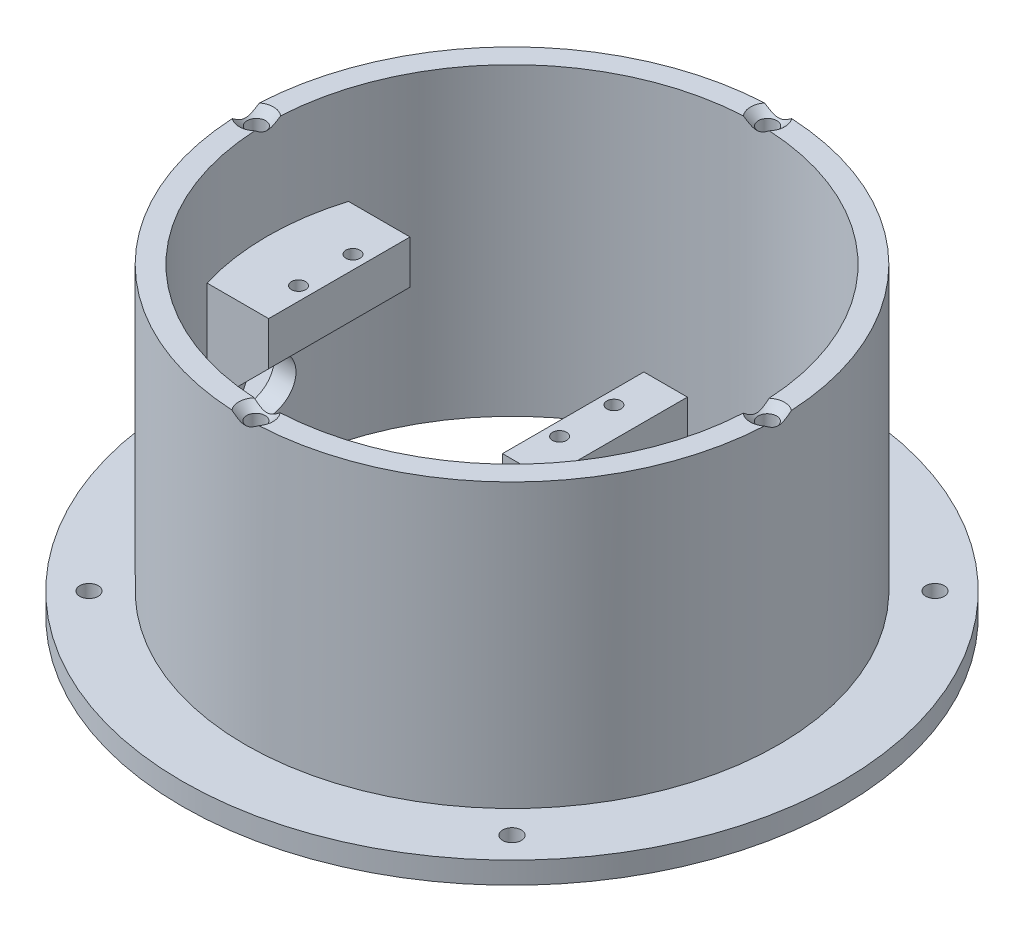
from build123d import *

# Parameters (mm, degrees)
BOSS_EXTRUDE1_START                             = -18.668682
BOSS_EXTRUDE1_OUTLINE_R                         = 49
BOSS_EXTRUDE1_DEPTH                             = 18.668682
BOSS_EXTRUDE1_START_2                           = -56
BOSS_EXTRUDE1_2_OUTLINE_R                       = 49
BOSS_EXTRUDE1_2_OUTLINE_R_2                     = 45
BOSS_EXTRUDE1_2_DEPTH                           = 37.331318
BOSS_EXTRUDE1_START_3                           = -4
BOSS_EXTRUDE1_3_OUTLINE_R                       = 60.625
BOSS_EXTRUDE1_3_OUTLINE_R_2                     = 49
BOSS_EXTRUDE1_3_DEPTH                           = 4
BOSS_EXTRUDE1_START_4                           = -13
BOSS_EXTRUDE1_4_DEPTH                           = 26
CUT_EXTRUDE1_DEPTH                              = 1.918682
CUT_EXTRUDE2_REACH                              = 112.599
CUT_EXTRUDE3_DEPTH                              = 103.404986
CUT_EXTRUDE4_DEPTH                              = 103.404986
CUT_EXTRUDE5_DEPTH                              = 12.75
CUT_EXTRUDE6_DEPTH                              = 18
SKETCH16_W                                      = 8
SKETCH16_H                                      = 26
BOSS_EXTRUDE2_DEPTH                             = 34
CUT_EXTRUDE7_DEPTH                              = 101.273532
CUT_EXTRUDE8_REACH                              = 111.441
SKETCH23_W                                      = 10
SKETCH23_H                                      = 24
F_3_4_3_4_DIAMETER_HOLE1_D                      = 3.4
SKETCH26_W                                      = 5
SKETCH26_H                                      = 105.34636
F_2_6_2_6_DIAMETER_HOLE1_D                      = 2.6
F_2_6_2_6_DIAMETER_HOLE1_DEPTH                  = 7.2
CSK_FOR_M3_FLAT_HEAD_MACHINE_SCREW1_D           = 3.4
CSK_FOR_M3_FLAT_HEAD_MACHINE_SCREW1_DEPTH       = 30.178537
CSK_FOR_M3_FLAT_HEAD_MACHINE_SCREW1_CSINK_D     = 6.3
CSK_FOR_M3_FLAT_HEAD_MACHINE_SCREW1_CSINK_ANGLE = 90
CSK_FOR_M3_FLAT_HEAD_MACHINE_SCREW1_TIP         = 1.021463


with BuildPart() as part:
    # Boss-Extrude1: read off the stored shape, not the designer's step
    # Boss-Extrude1 outline → Boss-Extrude1 (new body)
    with BuildSketch(Plane.XZ.offset(BOSS_EXTRUDE1_START)):
        Circle(BOSS_EXTRUDE1_OUTLINE_R)
        with BuildLine():
            Line((-10.445584, 13), (29.067401, -34.352383))
            ThreePointArc((29.067401, -34.352383), (-34.551051, -28.830971), (-28.593183, 34.748092))
            Line((-28.593183, 34.748092), (-10.445584, 13))
        make_face(mode=Mode.SUBTRACT)
    extrude(amount=BOSS_EXTRUDE1_DEPTH)

    # Boss-Extrude1 2 outline → Boss-Extrude1 2 (add)
    with BuildSketch(Plane.XZ.offset(BOSS_EXTRUDE1_START_2)):
        Circle(BOSS_EXTRUDE1_2_OUTLINE_R)
        Circle(BOSS_EXTRUDE1_2_OUTLINE_R_2, mode=Mode.SUBTRACT)
    extrude(amount=BOSS_EXTRUDE1_2_DEPTH)

    # Boss-Extrude1 3 outline → Boss-Extrude1 3 (add)
    with BuildSketch(Plane.XZ.offset(BOSS_EXTRUDE1_START_3)):
        Circle(BOSS_EXTRUDE1_3_OUTLINE_R)
        Circle(BOSS_EXTRUDE1_3_OUTLINE_R_2, mode=Mode.SUBTRACT)
    extrude(amount=BOSS_EXTRUDE1_3_DEPTH)

    # Boss-Extrude1 4 outline → Boss-Extrude1 4 (add)
    with BuildSketch(Plane.XY.offset(BOSS_EXTRUDE1_START_4)):
        Polygon((-46.75, 15), (-5.75, 56), (-47, 56), (-47, 15), align=None)
    extrude(amount=BOSS_EXTRUDE1_4_DEPTH)

    # Sketch2 → Cut-Extrude1 (cut)
    with BuildSketch(Plane(origin=(0, 18.668682, 0), x_dir=(-1, 0, 0), z_dir=(0, 1, 0))):
        with BuildLine():
            Line((-29.067401, -34.352383), (28.593183, 34.748092))
            ThreePointArc((28.593183, 34.748092), (-34.551051, 28.830971), (-29.067401, -34.352383))
        make_face()
    extrude(amount=-CUT_EXTRUDE1_DEPTH, mode=Mode.SUBTRACT)

    # Sketch7 → Cut-Extrude2 (cut, up to next)
    with BuildSketch(Plane.XY.offset(13), mode=Mode.PRIVATE) as cut_extrude2_sk1:
        Polygon((-31.75, 56), (-31.75, 30), (-5.75, 56), align=None)
    cut_extrude2_tool1 = extrude(cut_extrude2_sk1.sketch, amount=-CUT_EXTRUDE2_REACH, mode=Mode.PRIVATE) & part.part
    add(cut_extrude2_tool1.solids().sort_by_distance((-23.083333, 47.333333, 13))[0], mode=Mode.SUBTRACT)

    # Sketch12 → Cut-Extrude3 (cut, through all)
    with BuildSketch(Plane.XZ):
        with BuildLine():
            Line((-28.593183, 34.748092), (0.402208, 0))
            Line((0.402208, 0), (29.067401, 34.352383))
            ThreePointArc((29.067401, 34.352383), (0.308816, 44.99894), (-28.593183, 34.748092))
        make_face()
    extrude(amount=-CUT_EXTRUDE3_DEPTH, mode=Mode.SUBTRACT)

    # Sketch13 → Cut-Extrude4 (cut, through all)
    with BuildSketch(Plane.XZ):
        Polygon((0.402208, 0), (11.25, -13), (11.25, 13), align=None)
    extrude(amount=-CUT_EXTRUDE4_DEPTH, mode=Mode.SUBTRACT)

    # Sketch14 → Cut-Extrude5 (cut)
    with BuildSketch(Plane(origin=(0, 16.75, 0), x_dir=(-1, 0, 0), z_dir=(0, 1, 0))):
        with BuildLine():
            Line((-11.25, -13), (-11.25, 13))
            Line((-11.25, 13), (-29.067401, 34.352383))
            ThreePointArc((-29.067401, 34.352383), (-45, 0), (-29.067401, -34.352383))
            Line((-29.067401, -34.352383), (-11.25, -13))
        make_face()
    extrude(amount=-CUT_EXTRUDE5_DEPTH, mode=Mode.SUBTRACT)

    # Sketch15 → Cut-Extrude6 (cut)
    with BuildSketch(Plane(origin=(0, 56, 0), x_dir=(-1, 0, 0), z_dir=(0, 1, 0))):
        with BuildLine():
            Line((43.081318, 13), (31.75, 13))
            Line((31.75, 13), (31.75, -13))
            Line((31.75, -13), (43.081318, -13))
            ThreePointArc((43.081318, -13), (45, 0), (43.081318, 13))
        make_face()
    extrude(amount=-CUT_EXTRUDE6_DEPTH, mode=Mode.SUBTRACT)

    # Sketch16 → Boss-Extrude2 (add)
    with BuildSketch(Plane(origin=(0, 4, 0), x_dir=(-1, 0, 0), z_dir=(0, 1, 0))):
        with Locations((-15.25, 0)):
            Rectangle(SKETCH16_W, SKETCH16_H)
    extrude(amount=BOSS_EXTRUDE2_DEPTH)

    # Sketch17 → Cut-Extrude7 (cut, through all)
    with BuildSketch(Plane(origin=(0, 4, 0), x_dir=(-1, 0, 0), z_dir=(0, 1, 0))):
        with BuildLine():
            Line((-29.479537, -22.359715), (-24.25, -16.092635))
            Line((-24.25, -16.092635), (-24.25, 16.092635))
            Line((-24.25, 16.092635), (-29.479537, 22.359715))
            ThreePointArc((-29.479537, 22.359715), (-37, 0), (-29.479537, -22.359715))
        make_face()
    extrude(amount=-CUT_EXTRUDE7_DEPTH, mode=Mode.SUBTRACT)

    # Sketch23 → Cut-Extrude8 (cut, up to next)
    with BuildSketch(Plane.ZY.offset(-11.25), mode=Mode.PRIVATE) as cut_extrude8_sk1:
        with Locations((0, 17)):
            Rectangle(SKETCH23_W, SKETCH23_H)
    cut_extrude8_tool1 = extrude(cut_extrude8_sk1.sketch, amount=-CUT_EXTRUDE8_REACH, mode=Mode.PRIVATE) & part.part
    add(cut_extrude8_tool1.solids().sort_by_distance((11.25, 17, 0))[0], mode=Mode.SUBTRACT)

    # Ø3.4 (3.4) Diameter Hole1 (through all)
    with Locations(Plane(origin=(0, 4, 0), x_dir=(1, 0, 0), z_dir=(0, 1, 0))):
        with Locations((38.890873, 38.890873), (38.890873, -38.890873), (-38.890873, -38.890873), (-38.890873, 38.890873)):
            Hole(F_3_4_3_4_DIAMETER_HOLE1_D / 2)

    # Sketch26 → Ø10.0 (10) Diameter Hole1 (revolve, cut)
    with BuildSketch(Plane(origin=(44.72136, 14, 0), x_dir=(0, 0, -1), z_dir=(0, 1, 0))):
        with Locations((2.5, 52.67318)):
            Rectangle(SKETCH26_W, SKETCH26_H)
    revolve(axis=Axis((51.07136, 14, 0), (-1, 0, 0)), mode=Mode.SUBTRACT)

    # Ø2.6 (2.6) Diameter Hole1
    with Locations(Plane(origin=(0, 38, 0), x_dir=(1, 0, 0), z_dir=(0, 1, 0))):
        with Locations((13.75, -5), (13.75, 5), (-34.25, 5), (-34.25, -5)):
            Hole(F_2_6_2_6_DIAMETER_HOLE1_D / 2, depth=F_2_6_2_6_DIAMETER_HOLE1_DEPTH)

    # CSK for M3 Flat Head Machine Screw1
    with Locations(Plane(origin=(0, 56, 0), x_dir=(1, 0, 0), z_dir=(0, 1, 0))):
        with Locations((0, 47), (-47, 0), (-0.090425, -46.999913), (46.999978, -0.045213)):
            CounterSinkHole(CSK_FOR_M3_FLAT_HEAD_MACHINE_SCREW1_D / 2, CSK_FOR_M3_FLAT_HEAD_MACHINE_SCREW1_CSINK_D / 2, depth=CSK_FOR_M3_FLAT_HEAD_MACHINE_SCREW1_DEPTH, counter_sink_angle=CSK_FOR_M3_FLAT_HEAD_MACHINE_SCREW1_CSINK_ANGLE)
            with Locations((0, 0, -(CSK_FOR_M3_FLAT_HEAD_MACHINE_SCREW1_DEPTH + CSK_FOR_M3_FLAT_HEAD_MACHINE_SCREW1_TIP / 2))):  # 118° drill point
                Cone(0, CSK_FOR_M3_FLAT_HEAD_MACHINE_SCREW1_D / 2, CSK_FOR_M3_FLAT_HEAD_MACHINE_SCREW1_TIP, mode=Mode.SUBTRACT)


solid = part.part
